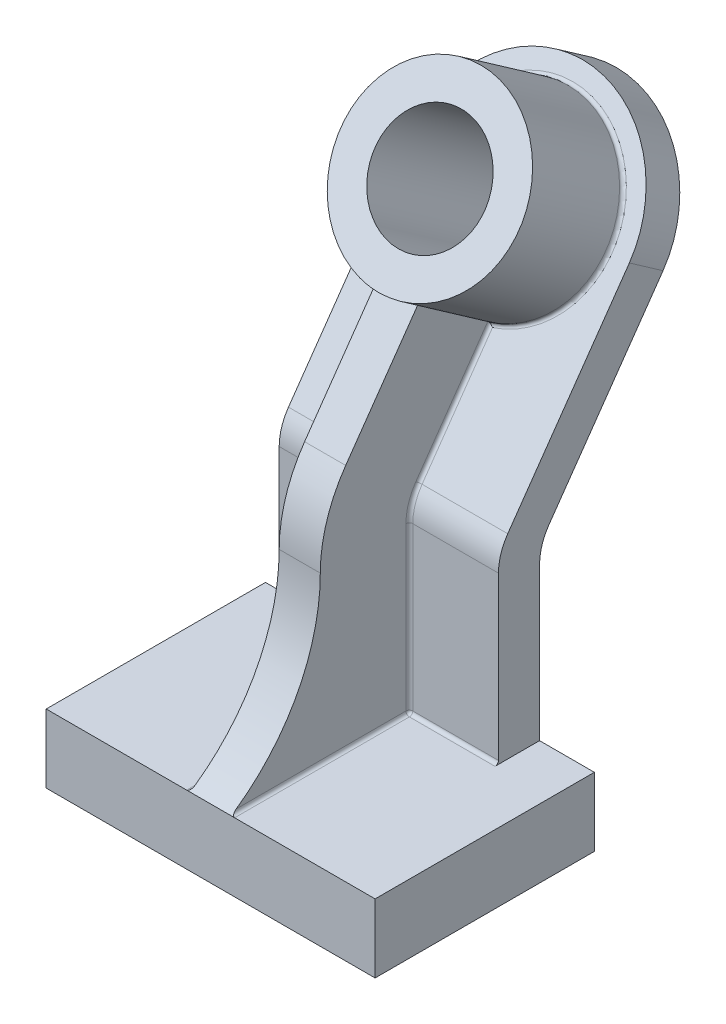
from build123d import *

# Parameters (mm, degrees)
SKETCH1_W               = 96
SKETCH1_H               = 64
BOSS_EXTRUDE1_DEPTH     = 20
BOSS_EXTRUDE2_DEPTH     = 32
BOSS_EXTRUDE3_DEPTH     = 12
SKETCH8_R               = 26
SKETCH8_R_2             = 16
BOSS_EXTRUDE4_DEPTH     = 32
CUT_EXTRUDE1_DEPTH      = 177.853582377
CUT_EXTRUDE1_DEPTH_BACK = 177.853582377
SKETCH9_R               = 16
RIB9_START              = -6
RIB9_DEPTH              = 12
FILLET1_R               = 1


with BuildPart() as part:
    # Sketch1 → Boss-Extrude1 (new body)
    with BuildSketch(Plane(origin=(0, 0, 0), x_dir=(1, 0, 0), z_dir=(0, 1, 0))):
        Rectangle(SKETCH1_W, SKETCH1_H)
    extrude(amount=-BOSS_EXTRUDE1_DEPTH)

    # Sketch4 → Boss-Extrude2 (add, symmetric)
    with BuildSketch(Plane(origin=(0, 0, 0), x_dir=(0, 0, -1), z_dir=(1, 0, 0))):
        with BuildLine():
            Line((20, -20), (32, -20))
            Line((32, -20), (32, 44.558859159))
            ThreePointArc((32, 44.558859159), (32.694245739, 49.069446152), (34.712719336, 53.162505705))
            Line((34.712719336, 53.162505705), (68.042689949, 100.762636801))
            Line((68.042689949, 100.762636801), (58.212865417, 107.645554037))
            Line((58.212865417, 107.645554037), (22.712719336, 56.946091171))
            ThreePointArc((22.712719336, 56.946091171), (20.694245739, 52.853031619), (20, 48.342444626))
            Line((20, 48.342444626), (20, -20))
        make_face()
    extrude(amount=BOSS_EXTRUDE2_DEPTH, both=True)

    # Sketch6 → Boss-Extrude3 (add)
    with BuildSketch(Plane(origin=(0, 8.063203075, 11.515447399), x_dir=(1, 0, 0), z_dir=(0, 0.573576436351053, 0.819152044288987))):
        with BuildLine():
            Line((-32, 121.567603544), (32, 121.567603544))
            ThreePointArc((32, 121.567603544), (0, 153.567603544), (-32, 121.567603544))
        make_face()
    extrude(amount=-BOSS_EXTRUDE3_DEPTH)

    # Sketch8 → Boss-Extrude4 (add)
    with BuildSketch(Plane(origin=(0, 8.063203075, 11.515447399), x_dir=(1, 0, 0), z_dir=(0, 0.573576436351053, 0.819152044288987))):
        with Locations(Location((0, 121.567603544, 0), (0, 0, 270))):
            Circle(SKETCH8_R)
        with Locations(Location((0, 121.567603544, 0), (0, 0, 270))):
            Circle(SKETCH8_R_2, mode=Mode.SUBTRACT)
    extrude(amount=BOSS_EXTRUDE4_DEPTH)

    # Sketch9 → Cut-Extrude1 (cut, two sides: drawn at the far end of the back side and taken through both)
    with BuildSketch(Plane(origin=(0, 8.063203075, 11.515447399), x_dir=(1, 0, 0), z_dir=(0, 0.573576436351053, 0.819152044288987)).offset(-CUT_EXTRUDE1_DEPTH_BACK)):
        with Locations(Location((0, 121.567603544, 0), (0, 0, 270))):
            Circle(SKETCH9_R)
    extrude(amount=CUT_EXTRUDE1_DEPTH + CUT_EXTRUDE1_DEPTH_BACK, mode=Mode.SUBTRACT)

    # Rib9: read off the stored shape, not the designer's step
    # Rib9 outline → Rib9 (add)
    with BuildSketch(Plane(origin=(0, 0, 0), x_dir=(0, 0, -1), z_dir=(1, 0, 0)).offset(RIB9_START)):
        with BuildLine():
            Line((22.712719336, 56.946091171), (43.702401809, 86.922464357))
            Line((43.702401809, 86.922464357), (22.404448657, 101.835451702))
            Line((22.404448657, 101.835451702), (1.414766184, 71.859078516))
            ThreePointArc((1.414766184, 71.859078516), (-4.102394981, 60.671382406), (-6, 48.342444626))
            ThreePointArc((-6, 48.342444626), (-12.91230776, 20.897080936), (-32, 0))
            Line((-32, 0), (20, 0))
            Line((20, 0), (20, 48.342444626))
            ThreePointArc((20, 48.342444626), (20.694245739, 52.853031619), (22.712719336, 56.946091171))
        make_face()
    extrude(amount=RIB9_DEPTH)

    # Fillet1
    # the kernel refuses this fillet: 1 mm, written as the material it adds along each edge
    with BuildSketch(Plane(origin=(-7, 1, -19), x_dir=(1, 0, 0), z_dir=(0, -1, 0))) as fillet1_piece_1_section:
        Polygon((0, 0), (FILLET1_R * 1.02, 0), (FILLET1_R * 1.02, -FILLET1_R * 1.02), (0, -FILLET1_R * 1.02), align=None)
    fillet1_piece_1 = extrude(amount=FILLET1_R * 1.02, mode=Mode.PRIVATE)
    fillet1_piece_1 = fillet1_piece_1 - Plane(origin=(-7, 1, -19), x_dir=(-0.7071067811865475, 0, 0.7071067811865475), z_dir=(0, -1, 0)) * Sphere(FILLET1_R, mode=Mode.PRIVATE)
    add(fillet1_piece_1)
    with BuildSketch(Plane(origin=(7, 1, -19), x_dir=(0, 0, -1), z_dir=(-1, 0, 0))) as fillet1_piece_2_section:
        Polygon((0, 0), (FILLET1_R * 1.02, 0), (FILLET1_R * 1.02, FILLET1_R * 1.02), (0, FILLET1_R * 1.02), align=None)
    fillet1_piece_2 = extrude(amount=FILLET1_R * 1.02, mode=Mode.PRIVATE)
    fillet1_piece_2 = fillet1_piece_2 - Plane(origin=(7, 1, -19), x_dir=(0, 0.7071067811865475, 0.7071067811865476), z_dir=(-1, 0, 0)) * Sphere(FILLET1_R, mode=Mode.PRIVATE)
    add(fillet1_piece_2)
    with BuildSketch(Plane(origin=(-6, 0, 34.5), x_dir=(-1, 0, 0), z_dir=(0, 0, -1))) as fillet1_piece_3_section:
        with BuildLine():
            CenterArc((FILLET1_R, FILLET1_R), FILLET1_R, 180, 90)
            Line((0, FILLET1_R), (0, 0))
            Line((0, 0), (FILLET1_R, 0))
        make_face()
    fillet1_piece_3 = extrude(amount=53.5, mode=Mode.PRIVATE)
    fillet1_piece_3 = fillet1_piece_3 - Plane(origin=(-6, 48.342444627, 63.942152933), x_dir=(0, -1.6764948068756696e-11, -1.0), z_dir=(-1, 0, 0)) * Cylinder(57.942152933, 111, mode=Mode.PRIVATE)
    add(fillet1_piece_3)
    with BuildSketch(Plane(origin=(-6, 1, -20), x_dir=(0, 0, 1), z_dir=(0, 1, 0)), Plane(origin=(6, 1, -20), x_dir=(1, 0, 0), z_dir=(0, 1, 0))) as fillet1_piece_4:
        with BuildLine():
            CenterArc((FILLET1_R, -FILLET1_R), FILLET1_R, 90, 90)
            Line((0, -FILLET1_R), (0, 0))
            Line((0, 0), (FILLET1_R, 0))
        make_face()
    extrude(amount=47.342444626)
    with BuildSketch(Plane(origin=(-6, 48.342444626, -34.999999997), x_dir=(0, -1.1790272464341429e-11, 1.0), z_dir=(0, -1.0, -1.1790272464341429e-11))) as fillet1_piece_5:
        with BuildLine():
            CenterArc((14.999999997 + FILLET1_R, FILLET1_R), FILLET1_R, 180, 90)
            Line((14.999999997, FILLET1_R), (14.999999997, 0))
            Line((14.999999997, 0), (14.999999997 + FILLET1_R, 0))
        make_face()
    revolve(axis=Axis((-6, 48.342444626, -34.999999997), (-1, 0, 0)), revolution_arc=35.000000006)
    with BuildSketch(Plane(origin=(-6, 56.946091171, -22.712719336), x_dir=(0, 0.5735764363505949, 0.8191520442893078), z_dir=(0, 0.8191520442893078, -0.5735764363505949))) as fillet1_piece_6:
        with BuildLine():
            CenterArc((FILLET1_R, -FILLET1_R), FILLET1_R, 90, 90)
            Line((FILLET1_R * 4.36944609845e-10, -FILLET1_R), (0, 0))
            Line((0, 0), (FILLET1_R, 0))
        make_face()
    extrude(amount=39.09439465)
    with BuildSketch(Plane(origin=(-7, 0, -20), x_dir=(0, 0, 1), z_dir=(-1, 0, 0)), Plane(origin=(32, 0, -20), x_dir=(0, 0, 1), z_dir=(-1, 0, 0))) as fillet1_piece_7:
        with BuildLine():
            CenterArc((FILLET1_R, FILLET1_R), FILLET1_R, 180, 90)
            Line((0, FILLET1_R), (0, 0))
            Line((0, 0), (FILLET1_R, 0))
        make_face()
    extrude(amount=25)
    with BuildSketch(Plane(origin=(0, 107.645554037, -58.212865417), x_dir=(0.13576209912183695, -0.8115678972317177, 0.5682659594106623), z_dir=(-0.990741465995056, -0.11120980103261684, 0.07786994100584167))) as fillet1_piece_8:
        with BuildLine():
            CenterArc((26 + FILLET1_R, FILLET1_R), FILLET1_R, 180, 90)
            Line((26, FILLET1_R), (26, 0))
            Line((26, 0), (26 + FILLET1_R, 0))
        make_face()
    revolve(axis=Axis((0, 107.645554037, -58.212865417), (0, 0.573576436351053, 0.819152044288987)), revolution_arc=344.394618628)
    with BuildSketch(Plane(origin=(6, 0, 34.5), x_dir=(1, 0, 0), z_dir=(0, 0, -1))) as fillet1_piece_9_section:
        with BuildLine():
            CenterArc((FILLET1_R, -FILLET1_R), FILLET1_R, 90, 90)
            Line((0, -FILLET1_R), (0, 0))
            Line((0, 0), (FILLET1_R, 0))
        make_face()
    fillet1_piece_9 = extrude(amount=53.5, mode=Mode.PRIVATE)
    fillet1_piece_9 = fillet1_piece_9 - Plane(origin=(6, 48.342444627, 63.942152933), x_dir=(0, -1.6764948068756696e-11, -1.0), z_dir=(-1, 0, 0)) * Cylinder(57.942152933, 111, mode=Mode.PRIVATE)
    add(fillet1_piece_9)
    with BuildSketch(Plane(origin=(6, 48.342444626, -34.999999997), x_dir=(0, -1.1790272464341429e-11, 1.0), z_dir=(0, -1.0, -1.1790272464341429e-11))) as fillet1_piece_10:
        with BuildLine():
            CenterArc((14.999999997 + FILLET1_R, -FILLET1_R), FILLET1_R, 90, 90)
            Line((14.999999997, -FILLET1_R), (14.999999997, 0))
            Line((14.999999997, 0), (14.999999997 + FILLET1_R, 0))
        make_face()
    revolve(axis=Axis((6, 48.342444626, -34.999999997), (-1, 0, 0)), revolution_arc=35.000000006)
    with BuildSketch(Plane(origin=(6, 56.946091171, -22.712719336), x_dir=(0, 0.5735764363505949, 0.8191520442893078), z_dir=(0, 0.8191520442893078, -0.5735764363505949))) as fillet1_piece_11:
        with BuildLine():
            CenterArc((FILLET1_R, FILLET1_R), FILLET1_R, 180, 90)
            Line((FILLET1_R * 4.36944609845e-10, FILLET1_R), (0, 0))
            Line((0, 0), (FILLET1_R, 0))
        make_face()
    extrude(amount=39.09439465)


solid = part.part
